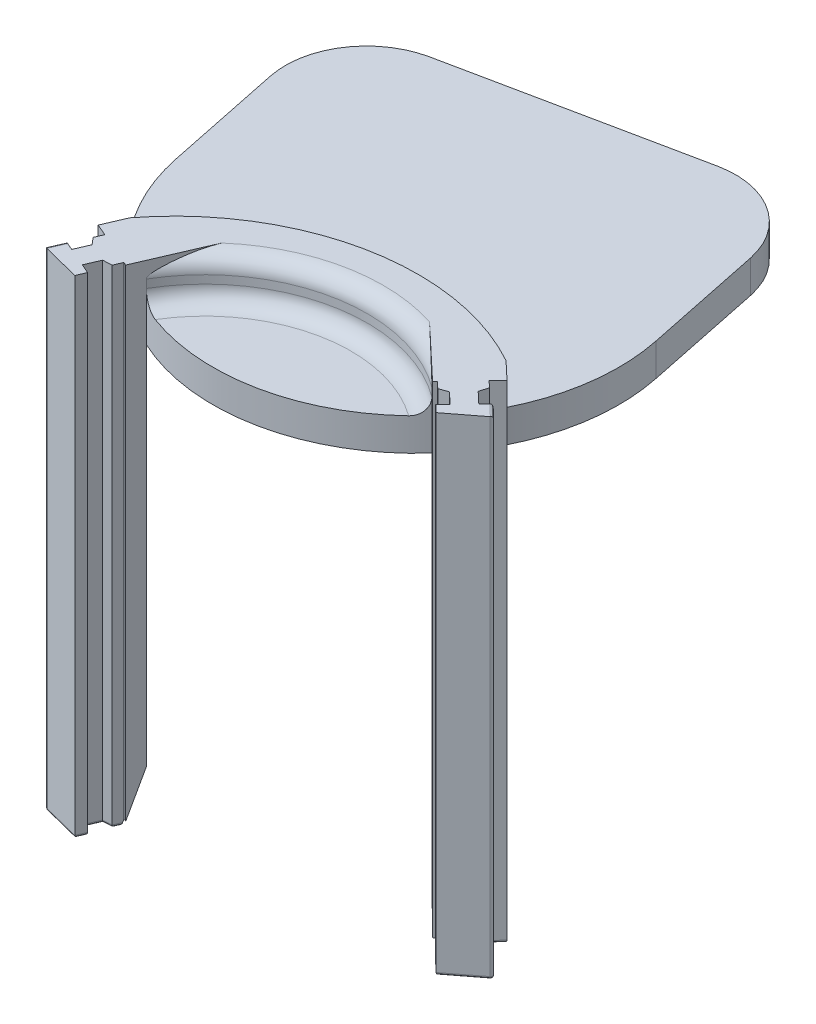
from build123d import *
from OCP.BRepFilletAPI import BRepFilletAPI_MakeChamfer

# Parameters (mm, degrees)
SKETCH_1_R           = 25
EXTRUDE_1_DEPTH      = 4
EXTRUDE_2_DEPTH      = 5
EXTRUDE_2_DEPTH_BACK = 55
EXTRUDE_3_DEPTH      = 5
FILLET_1_R           = 2
CHAMFER_1_SIZE       = 6
CHAMFER_1_SIZE2      = 2.1838214055972194
CHAMFER_2_SIZE       = 1.5
CHAMFER_2_SIZE_2     = 1.205612412
FILLET_3_R           = 0.3
FILLET_4_R           = 0.3
EXTRUDE_START        = -4
EXTRUDE_4_DEPTH      = 4
FILLET_5_R           = 10


with BuildPart() as part:
    # 草图1 → 凸台-拉伸1 (new body)
    with BuildSketch(Plane(origin=(0, 0, 0), x_dir=(1, 0, 0), z_dir=(0, 1, 0))):
        with Locations(Location((0, 0, 0), (0, 0, 270))):
            Circle(SKETCH_1_R)
    extrude(amount=EXTRUDE_1_DEPTH)

    # 草图2 → 凸台-拉伸2 (add, two sides: drawn at the far end of the back side and taken through both)
    with BuildSketch(Plane(origin=(0, 4, 0), x_dir=(1, 0, 0), z_dir=(0, 1, 0)).offset(-EXTRUDE_2_DEPTH_BACK)):
        with BuildLine():
            ThreePointArc((22.332503325570293, -11.236516151075708), (20.662728753668315, -14.073082123412792), (18.634769791146837, -16.66569394987657))
            Line((18.634769791146837, -16.665693949876566), (20.041241701767298, -17.99217884081352))
            Line((20.041241701767298, -17.99217884081352), (20.33291534076991, -17.682917285609623))
            Line((20.33291534076991, -17.682917285609623), (21.12987507649821, -18.43455337599002))
            Line((21.12987507649821, -18.43455337599002), (22.1797380423832, -18.050121648809256))
            Line((22.1797380423832, -18.050121648809256), (23.565250010950724, -19.3568386039359))
            Line((23.565250010950724, -19.3568386039359), (22.70760290865611, -20.266201814059144))
            Line((22.70760290865611, -20.266201814059144), (23.58059159037443, -21.089543032261975))
            Line((23.58059159037443, -21.089543032261975), (27.59317245403172, -18.00098433723753))
            Line((27.59317245403172, -18.00098433723753), (26.13819131783453, -16.628748973566147))
            Line((26.13819131783453, -16.628748973566147), (25.280544215539912, -17.538112183689385))
            Line((25.280544215539912, -17.538112183689385), (23.895032246972406, -16.231395228562743))
            Line((23.895032246972406, -16.231395228562743), (24.217404644758776, -15.160845819546308))
            Line((24.217404644758776, -15.160845819546308), (23.420444909030483, -14.409209729165896))
            Line((23.420444909030483, -14.409209729165896), (24.49191969238528, -13.27312503191597))
            Line((24.49191969238528, -13.27312503191597), (22.33250332557029, -11.23651615107571))
        make_face()
        with BuildLine():
            ThreePointArc((-16.04897580423937, -19.168473482125453), (-13.3915934082896, -21.110784589566084), (-10.502070341010478, -22.68714434547619))
            Line((-10.502070341010478, -22.68714434547619), (-11.267516680153959, -24.462480173746464))
            Line((-11.267516680153959, -24.462480173746464), (-11.657885741287837, -24.294170288933902))
            Line((-11.657885741287837, -24.294170288933902), (-12.091616345896137, -25.300142155021895))
            Line((-12.091616345896137, -25.300142155021895), (-13.207861579430748, -25.36336065398598))
            Line((-13.207861579430748, -25.36336065398598), (-13.961900857550162, -27.11223954713794))
            Line((-13.961900857550162, -27.11223954713794), (-12.814046374533504, -27.60714366494114))
            Line((-12.814046374533504, -27.60714366494114), (-13.289154327624585, -28.70908396863715))
            Line((-13.289154327624585, -28.70908396863715), (-18.19731089508523, -27.464094366554956))
            Line((-18.19731089508523, -27.464094366554956), (-17.40546430660011, -25.627527193728316))
            Line((-17.40546430660011, -25.627527193728316), (-16.25760982358345, -26.122431311531514))
            Line((-16.25760982358345, -26.122431311531514), (-15.503570545464036, -24.37355241837955))
            Line((-15.503570545464036, -24.37355241837955), (-16.223892484756064, -23.518487330930324))
            Line((-16.223892484756064, -23.518487330930324), (-15.79016188014775, -22.51251546484231))
            Line((-15.79016188014775, -22.51251546484231), (-17.22419824571416, -21.894222368549144))
            Line((-17.22419824571416, -21.894222368549144), (-16.04897580423937, -19.168473482125453))
        make_face()
    extrude(amount=EXTRUDE_2_DEPTH + EXTRUDE_2_DEPTH_BACK)

    # 草图3 → 凸台-拉伸3 (add)
    with BuildSketch(Plane(origin=(0, 4, 0), x_dir=(1, 0, 0), z_dir=(0, 1, 0))):
        with BuildLine():
            ThreePointArc((-10.502070341010494, -22.687144345476195), (2.7240849225224126, -13.181413393683862), (18.63476979114697, -16.665693949876687))
            ThreePointArc((18.63476979114697, -16.665693949876687), (20.662728753668432, -14.0730821234129), (22.332503325570396, -11.236516151075817))
            ThreePointArc((22.332503325570396, -11.236516151075817), (1.6674612067741998, -8.068579398056713), (-16.048975804239276, -19.168473482125343))
            ThreePointArc((-16.048975804239276, -19.168473482125343), (-13.39159340828953, -21.110784589565984), (-10.502070341010494, -22.687144345476195))
        make_face()
    extrude(amount=EXTRUDE_3_DEPTH)

    # 圆角1
    # the kernel refuses this fillet: 2 mm, written as the material it adds along each edge
    with BuildSketch(Plane(origin=(6.771773946405894, 4, 32.767536378234254), x_dir=(-0.9615700147021181, 0, -0.2745598419757852), z_dir=(-0.2745598419757852, 0, 0.9615700147021181))) as fillet_1_piece_1_section:
        with BuildLine():
            CenterArc((20 - FILLET_1_R, -FILLET_1_R), FILLET_1_R, 0, 90)
            Line((20, -FILLET_1_R), (20, 0))
            Line((20, 0), (20 - FILLET_1_R, 0))
        make_face()
    fillet_1_piece_1 = revolve(axis=Axis((6.771773946405894, 4, 32.767536378234254), (0, -1, 0)), revolution_arc=124.77556932584883, mode=Mode.PRIVATE)
    fillet_1_piece_1 = fillet_1_piece_1 & Plane(origin=(0, 4, 0), x_dir=(-1.8e-16, 0, 1), z_dir=(0, -1, 0)) * Cylinder(25, 80, mode=Mode.PRIVATE)
    add(fillet_1_piece_1)
    # the kernel refuses this fillet: 2 mm, written as the material it takes off along each edge
    with BuildSketch(Plane(origin=(6.771773946405894, 9, 32.767536378234254), x_dir=(-0.9754376414268184, 0, 0.22027575374445013), z_dir=(0.22027575374445013, 0, 0.9754376414268184))) as fillet_1_2_piece_1_section:
        with BuildLine():
            CenterArc((20 + FILLET_1_R, FILLET_1_R), FILLET_1_R, 180, 90.00000000000023)
            Line((20 + FILLET_1_R, 0), (20, 0))
            Line((20, 0), (20, FILLET_1_R))
        make_face()
    fillet_1_2_piece_1 = revolve(axis=Axis((6.771773946405894, 9, 32.767536378234254), (0, -1, 0)), revolution_arc=182.09759971066305, mode=Mode.PRIVATE)
    fillet_1_2_piece_1 = split(fillet_1_2_piece_1, bisect_by=Plane(origin=(20.393508222166147, 9, 18.32441172322201), z_dir=(-0.6861176818356919, 0, 0.7274905680985948)), keep=Keep.TOP, mode=Mode.PRIVATE)
    fillet_1_2_piece_1 = split(fillet_1_2_piece_1, bisect_by=Plane(origin=(-11.459231222339927, 9, 24.907132761573898), z_dir=(0.9182835864133222, 0, 0.3959232942425675)), keep=Keep.TOP, mode=Mode.PRIVATE)
    add(fillet_1_2_piece_1, mode=Mode.SUBTRACT)

    # 倒角1: one chamfer whose edges measure the first distance from different faces: ONE call of the kernel's chamfer builder (chamfer() names one face for all edges)
    chamfer_1_edges_1 = [part.edges().sort_by_distance(p)[0] for p in [
        (20.662728753668315, -51, 14.07308212341279),
    ]]
    chamfer_1_side_1 = [part.faces().sort_by_distance(p)[0] for p in [
        (20.662728753668432, -25.5, 14.07308212341262),
    ]]
    chamfer_1_edges_2 = [part.edges().sort_by_distance(p)[0] for p in [
        (-13.391593408289594, -51, 21.110784589566087),
    ]]
    chamfer_1_side_2 = [part.faces().sort_by_distance(p)[0] for p in [
        (-13.391593408289655, -25.5, 21.110784589566045),
    ]]
    chamfer_1 = BRepFilletAPI_MakeChamfer(part.part.solid().wrapped)
    for e in chamfer_1_edges_1:
        chamfer_1.Add(CHAMFER_1_SIZE, CHAMFER_1_SIZE2, e.wrapped, chamfer_1_side_1[0].wrapped)  # the first distance lies on this face
    for e in chamfer_1_edges_2:
        chamfer_1.Add(CHAMFER_1_SIZE, CHAMFER_1_SIZE2, e.wrapped, chamfer_1_side_2[0].wrapped)  # the first distance lies on this face
    add(Compound.cast(chamfer_1.Shape()), mode=Mode.REPLACE)

    # 倒角2
    # the kernel refuses this chamfer: 1.5, 1.205612412 mm, written as the material it takes off along each edge
    with BuildSketch(Plane(origin=(22.332503325570293, 0, 11.236516151075708), x_dir=(-0.47116075086138987, 0, 0.8820473608870054), z_dir=(0, -1, 0))) as chamfer_2_piece_1:
        with BuildLine():
            Line((1.222119237738874, -1e-17), (CHAMFER_2_SIZE * 0.262423288211, -CHAMFER_2_SIZE * 0.964952857815))
            Line((CHAMFER_2_SIZE * 0.262423288211, -CHAMFER_2_SIZE * 0.964952857815), (0, 0))
            ThreePointArc((0, 0), (0.625982518906451, -0.00746453901404494), (1.222119237738874, -1e-17))
        make_face()
    extrude(amount=51.55779161931309, mode=Mode.SUBTRACT)
    with BuildSketch(Plane(origin=(-16.04897580423937, -48.98240907030912, 19.168473482125453), x_dir=(-0.3959232942425711, 0, 0.9182835864133205), z_dir=(0, 1, 0))) as chamfer_2_piece_2:
        with BuildLine():
            Line((CHAMFER_2_SIZE_2, 3e-17), (0.396644602606295, 1.497059162425037))
            ThreePointArc((0.396644602606295, 1.497059162425037), (0.21551433141200554, 0.7666183767278043), (0, 0))
            Line((0, 0), (CHAMFER_2_SIZE_2, 3e-17))
        make_face()
    extrude(amount=48.98240907030912, mode=Mode.SUBTRACT)

    # 圆角3
    # the kernel refuses this fillet: 0.3 mm, written as the material it takes off along each edge
    with BuildSketch(Plane(origin=(-15.79016188014775, -51, 22.51251546484231), x_dir=(0, 1, 0), z_dir=(-0.9182835864133239, 0, -0.39592329424256356))) as fillet_3_piece_1:
        with BuildLine():
            CenterArc((FILLET_3_R, FILLET_3_R), FILLET_3_R, 180, 90)
            Line((0, FILLET_3_R), (0, 0))
            Line((0, 0), (FILLET_3_R, 0))
        make_face()
    extrude(amount=2.311648696311276, mode=Mode.SUBTRACT)
    with BuildSketch(Plane(origin=(-16.52083495543801, -51, 24.20720002074031), x_dir=(0, 1, 0), z_dir=(0.39592329424259415, 0, -0.9182835864133108))) as fillet_3_piece_2:
        with BuildLine():
            CenterArc((FILLET_3_R, FILLET_3_R), FILLET_3_R, 180, 90)
            Line((0, FILLET_3_R), (0, 0))
            Line((0, 0), (FILLET_3_R, 0))
        make_face()
    extrude(amount=1.8454915028125507, mode=Mode.SUBTRACT)
    with BuildSketch(Plane(origin=(-15.0203638988816, -51, 24.947147516596534), x_dir=(0, 1, 0), z_dir=(-0.6442755287765851, 0, -0.7647934642893149))) as fillet_3_piece_3_section:
        with BuildLine():
            CenterArc((FILLET_3_R, FILLET_3_R), FILLET_3_R, 180.00000000000026, 89.99999999999977)
            Line((0, FILLET_3_R), (0, 0))
            Line((0, 0), (FILLET_3_R, 0))
        make_face()
    fillet_3_piece_3 = extrude(amount=2.6180339887498807, mode=Mode.PRIVATE)
    fillet_3_piece_3 = split(fillet_3_piece_3, bisect_by=Plane(origin=(-15.636367255434342, -51, 24.68155409665593), z_dir=(-0.9182835864133249, 0, -0.3959232942425614)), keep=Keep.TOP, mode=Mode.PRIVATE)
    add(fillet_3_piece_3, mode=Mode.SUBTRACT)
    with BuildSketch(Plane(origin=(-16.25760982358345, -51, 26.122431311531514), x_dir=(0, 1, 0), z_dir=(0.3959232942425614, 0, -0.9182835864133249))) as fillet_3_piece_4_section:
        with BuildLine():
            CenterArc((FILLET_3_R, FILLET_3_R), FILLET_3_R, 180.0000000000003, 89.99999999999966)
            Line((0, FILLET_3_R), (0, 0))
            Line((0, 0), (FILLET_3_R, 0))
        make_face()
    fillet_3_piece_4 = extrude(amount=2.654508497187472, mode=Mode.PRIVATE)
    fillet_3_piece_4 = split(fillet_3_piece_4, bisect_by=Plane(origin=(-14.954826843827128, -51, 25.024943908257733), z_dir=(-0.7647934642893149, 0, 0.6442755287765851)), keep=Keep.TOP, mode=Mode.PRIVATE)
    add(fillet_3_piece_4, mode=Mode.SUBTRACT)
    with BuildSketch(Plane(origin=(-18.094176996410106, -51, 25.330584723046396), x_dir=(4.31e-15, 1, -9.99e-15), z_dir=(0.9182835864133262, 0, 0.39592329424255845))) as fillet_3_piece_5:
        with BuildLine():
            CenterArc((FILLET_3_R, FILLET_3_R), FILLET_3_R, 180, 90.00000000000063)
            Line((-3.26e-15, FILLET_3_R), (0, 0))
            Line((0, 0), (FILLET_3_R, 0))
        make_face()
    extrude(amount=2.000000000000003, mode=Mode.SUBTRACT)
    with BuildSketch(Plane(origin=(-18.49425336576715, -51, 28.152807056364946), x_dir=(-9.99e-15, 1, -4.31e-15), z_dir=(0.3959232942425625, 0, -0.9182835864133243))) as fillet_3_piece_6:
        with BuildLine():
            CenterArc((FILLET_3_R, FILLET_3_R), FILLET_3_R, 180.00000000000063, 90)
            Line((-3.26e-15, FILLET_3_R), (0, 0))
            Line((0, 0), (FILLET_3_R, 0))
        make_face()
    extrude(amount=3.4999999999999822, mode=Mode.SUBTRACT)
    with BuildSketch(Plane(origin=(-12.562177344246667, -51, 28.893486966548615), x_dir=(-3.6e-16, 1, 1.41e-15), z_dir=(-0.9693026445038965, 0, -0.2458706638819543))) as fillet_3_piece_7:
        with BuildLine():
            CenterArc((FILLET_3_R, FILLET_3_R), FILLET_3_R, 180, 90.00000000000006)
            Line((-4.4e-16, FILLET_3_R), (0, 0))
            Line((0, 0), (FILLET_3_R, 0))
        make_face()
    extrude(amount=6.563595560468844, mode=Mode.SUBTRACT)
    with BuildSketch(Plane(origin=(-12.517103903851584, -51, 26.918430975131148), x_dir=(0, 1, 0), z_dir=(-0.3959232942425612, 0, 0.918283586413325))) as fillet_3_piece_8:
        with BuildLine():
            CenterArc((FILLET_3_R, FILLET_3_R), FILLET_3_R, 180, 90)
            Line((0, FILLET_3_R), (0, 0))
            Line((0, 0), (FILLET_3_R, 0))
        make_face()
    extrude(amount=2.700000000000018, mode=Mode.SUBTRACT)
    with BuildSketch(Plane(origin=(-13.961900857550162, -51, 27.11223954713794), x_dir=(0, 1, 0), z_dir=(0.9182835864133251, 0, 0.3959232942425608))) as fillet_3_piece_9:
        with BuildLine():
            CenterArc((FILLET_3_R, FILLET_3_R), FILLET_3_R, 180, 90)
            Line((0, FILLET_3_R), (0, 0))
            Line((0, 0), (FILLET_3_R, 0))
        make_face()
    extrude(amount=1.9999999999999993, mode=Mode.SUBTRACT)
    with BuildSketch(Plane(origin=(-12.910919108748827, -51, 24.674647964175985), x_dir=(0, 1, 0), z_dir=(-0.39592329424256206, 0, 0.9182835864133245))) as fillet_3_piece_10_section:
        with BuildLine():
            CenterArc((FILLET_3_R, FILLET_3_R), FILLET_3_R, 180, 90)
            Line((0, FILLET_3_R), (0, 0))
            Line((0, 0), (FILLET_3_R, 0))
        make_face()
    fillet_3_piece_10 = extrude(amount=2.6545084971874693, mode=Mode.PRIVATE)
    fillet_3_piece_10 = split(fillet_3_piece_10, bisect_by=Plane(origin=(-12.872988009370376, -51, 25.344395104296755), z_dir=(0.05654434444767595, 0, 0.9984000886974033)), keep=Keep.TOP, mode=Mode.PRIVATE)
    add(fillet_3_piece_10, mode=Mode.SUBTRACT)
    with BuildSketch(Plane(origin=(-11.34281627937308, -51, 25.257733896686137), x_dir=(-2e-17, 1, -3.3e-16), z_dir=(-0.9984000886974033, 0, 0.05654434444767595))) as fillet_3_piece_11_section:
        with BuildLine():
            CenterArc((FILLET_3_R, FILLET_3_R), FILLET_3_R, 180, 90)
            Line((1e-16, FILLET_3_R), (0, 0))
            Line((0, 0), (FILLET_3_R, 0))
        make_face()
    fillet_3_piece_11 = extrude(amount=2.6180339887499082, mode=Mode.PRIVATE)
    fillet_3_piece_11 = split(fillet_3_piece_11, bisect_by=Plane(origin=(-12.877103222339173, -51, 24.59621718250296), z_dir=(0.9182835864133245, 0, 0.39592329424256206)), keep=Keep.TOP, mode=Mode.PRIVATE)
    add(fillet_3_piece_11, mode=Mode.SUBTRACT)
    with BuildSketch(Plane(origin=(-11.454986429527157, -51, 23.82357633704021), x_dir=(-4.31e-15, 1, -1.86e-15), z_dir=(-0.3959232942425903, 0, 0.9182835864133124))) as fillet_3_piece_12:
        with BuildLine():
            CenterArc((FILLET_3_R, FILLET_3_R), FILLET_3_R, 180, 89.99999999999972)
            Line((1.41e-15, FILLET_3_R), (0, 0))
            Line((0, 0), (FILLET_3_R, 0))
        make_face()
    extrude(amount=2.3579627686137226, mode=Mode.SUBTRACT)
    with BuildSketch(Plane(origin=(-8.0647e-13, -51, 8.2778e-13), x_dir=(-0.6384487948747662, 0, 0.7696643010579083), z_dir=(-0.7696643010579083, 0, -0.6384487948747662))) as fillet_3_piece_13:
        with BuildLine():
            CenterArc((27.183821405596213 + FILLET_3_R * 0.70020753821, FILLET_3_R), FILLET_3_R, 199.99999999999991, 70.00000000000075)
            Line((27.183821405596213 + FILLET_3_R * 0.70020753821, 0), (27.183821405596213, 0))
            Line((27.183821405596213, 0), (27.183821405596213 - FILLET_3_R * 0.239485082576, FILLET_3_R * 0.657979856674))
        make_face()
    revolve(axis=Axis((-8.0647e-13, -51, 8.2778e-13), (0, 1, 0)), revolution_arc=15.168674338711297, mode=Mode.SUBTRACT)
    with BuildSketch(Plane(origin=(-17.521140716396086, -51, 22.582935058359134), x_dir=(0, 1, 0), z_dir=(0.3959232942425718, 0, -0.9182835864133204))) as fillet_3_piece_14:
        with BuildLine():
            CenterArc((FILLET_3_R, FILLET_3_R), FILLET_3_R, 180, 90)
            Line((0, FILLET_3_R), (0, 0))
            Line((0, 0), (FILLET_3_R, 0))
        make_face()
    extrude(amount=2.1974345774697372, mode=Mode.SUBTRACT)
    with BuildSketch(Plane(origin=(20.425605588864702, -51, 18.692438018395173), x_dir=(-0.3438461898735354, 0, -0.9390259835113471), z_dir=(0.9390259835113471, 0, -0.3438461898735353))) as fillet_3_piece_15_section:
        with BuildLine():
            CenterArc((FILLET_3_R, FILLET_3_R), FILLET_3_R, 180, 90)
            Line((-1.22e-15, FILLET_3_R), (0, 0))
            Line((0, 0), (FILLET_3_R, 0))
        make_face()
    fillet_3_piece_15 = extrude(amount=2.6180339887498953, mode=Mode.PRIVATE)
    fillet_3_piece_15 = split(fillet_3_piece_15, bisect_by=Plane(origin=(21.57198500384515, -51, 17.476931941319044), z_dir=(-0.6861176818356887, 0, 0.727490568098598)), keep=Keep.TOP, mode=Mode.PRIVATE)
    add(fillet_3_piece_15, mode=Mode.SUBTRACT)
    with BuildSketch(Plane(origin=(21.63412011630925, -51, 17.53553338743249), x_dir=(0.6861176818356886, 0, -0.7274905680985979), z_dir=(0.727490568098598, 0, 0.6861176818356887))) as fillet_3_piece_16_section:
        with BuildLine():
            CenterArc((FILLET_3_R, FILLET_3_R), FILLET_3_R, 180, 90)
            Line((-2.58e-15, FILLET_3_R), (0, 0))
            Line((0, 0), (FILLET_3_R, 0))
        make_face()
    fillet_3_piece_16 = extrude(amount=2.6545084971874755, mode=Mode.PRIVATE)
    fillet_3_piece_16 = split(fillet_3_piece_16, bisect_by=Plane(origin=(21.864779152617707, -51, 18.165451166963482), z_dir=(0.3438461898735353, 0, 0.9390259835113471)), keep=Keep.TOP, mode=Mode.PRIVATE)
    add(fillet_3_piece_16, mode=Mode.SUBTRACT)
    with BuildSketch(Plane(origin=(23.565250010950724, -51, 19.3568386039359), x_dir=(0.7274905680985962, 0, 0.6861176818356907), z_dir=(-0.6861176818356906, 0, 0.7274905680985962))) as fillet_3_piece_17:
        with BuildLine():
            CenterArc((FILLET_3_R, FILLET_3_R), FILLET_3_R, 180, 90)
            Line((0, FILLET_3_R), (0, 0))
            Line((0, 0), (FILLET_3_R, 0))
        make_face()
    extrude(amount=1.9999999999999976, mode=Mode.SUBTRACT)
    with BuildSketch(Plane(origin=(22.161984982582165, -51, 19.75161355268238), x_dir=(0.6861176818356902, 0, -0.7274905680985964), z_dir=(0.7274905680985965, 0, 0.6861176818356903))) as fillet_3_piece_18:
        with BuildLine():
            CenterArc((FILLET_3_R, FILLET_3_R), FILLET_3_R, 180, 90)
            Line((-2.58e-15, FILLET_3_R), (0, 0))
            Line((0, 0), (FILLET_3_R, 0))
        make_face()
    extrude(amount=2.699999999999997, mode=Mode.SUBTRACT)
    with BuildSketch(Plane(origin=(22.986263782830427, -51, 21.547008284690996), x_dir=(-0.6099536699053572, 0, -0.7924370767253301), z_dir=(0.7924370767253301, 0, -0.6099536699053572))) as fillet_3_piece_19:
        with BuildLine():
            CenterArc((FILLET_3_R, FILLET_3_R), FILLET_3_R, 180, 90)
            Line((0, FILLET_3_R), (0, 0))
            Line((0, 0), (FILLET_3_R, 0))
        make_face()
    extrude(amount=6.563595560468856, mode=Mode.SUBTRACT)
    with BuildSketch(Plane(origin=(28.138790380105664, -51, 18.515572598614295), x_dir=(-0.6861176818356914, 0, 0.7274905680985952), z_dir=(-0.7274905680985954, 0, -0.6861176818356914))) as fillet_3_piece_20:
        with BuildLine():
            CenterArc((FILLET_3_R, FILLET_3_R), FILLET_3_R, 180, 90)
            Line((0, FILLET_3_R), (0, 0))
            Line((0, 0), (FILLET_3_R, 0))
        make_face()
    extrude(amount=3.499999999999993, mode=Mode.SUBTRACT)
    with BuildSketch(Plane(origin=(26.6527795792113, -51, 16.083131047492206), x_dir=(0.727490568098592, 0, 0.6861176818356949), z_dir=(-0.6861176818356949, 0, 0.7274905680985921))) as fillet_3_piece_21:
        with BuildLine():
            CenterArc((FILLET_3_R, FILLET_3_R), FILLET_3_R, 180, 90)
            Line((-2.58e-15, FILLET_3_R), (0, 0))
            Line((0, 0), (FILLET_3_R, 0))
        make_face()
    extrude(amount=1.9999999999999947, mode=Mode.SUBTRACT)
    with BuildSketch(Plane(origin=(25.280544215539912, -51, 17.538112183689385), x_dir=(-0.6861176818356933, 0, 0.7274905680985935), z_dir=(-0.7274905680985936, 0, -0.6861176818356934))) as fillet_3_piece_22_section:
        with BuildLine():
            CenterArc((FILLET_3_R, FILLET_3_R), FILLET_3_R, 180, 90)
            Line((0, FILLET_3_R), (0, 0))
            Line((0, 0), (FILLET_3_R, 0))
        make_face()
    fillet_3_piece_22 = extrude(amount=2.6545084971874626, mode=Mode.PRIVATE)
    fillet_3_piece_22 = split(fillet_3_piece_22, bisect_by=Plane(origin=(23.649447858635256, -51, 17.046943407015114), z_dir=(0.9575285007332007, 0, 0.2883386382079743)), keep=Keep.TOP, mode=Mode.PRIVATE)
    add(fillet_3_piece_22, mode=Mode.SUBTRACT)
    with BuildSketch(Plane(origin=(23.678778268316425, -51, 16.949541604112643), x_dir=(-0.9575285007332006, 0, -0.28833863820797423), z_dir=(0.2883386382079743, 0, -0.9575285007332007))) as fillet_3_piece_23_section:
        with BuildLine():
            CenterArc((FILLET_3_R, FILLET_3_R), FILLET_3_R, 180, 90)
            Line((0, FILLET_3_R), (0, 0))
            Line((0, 0), (FILLET_3_R, 0))
        make_face()
    fillet_3_piece_23 = extrude(amount=2.618033988749881, mode=Mode.PRIVATE)
    fillet_3_piece_23 = split(fillet_3_piece_23, bisect_by=Plane(origin=(24.139040001461176, -51, 16.46152609513513), z_dir=(0.6861176818356933, 0, -0.7274905680985935)), keep=Keep.TOP, mode=Mode.PRIVATE)
    add(fillet_3_piece_23, mode=Mode.SUBTRACT)
    with BuildSketch(Plane(origin=(24.76302257083274, -51, 15.675434080923063), x_dir=(-0.6861176818356722, 0, 0.7274905680986133), z_dir=(-0.7274905680986135, 0, -0.6861176818356722))) as fillet_3_piece_24:
        with BuildLine():
            CenterArc((FILLET_3_R, FILLET_3_R), FILLET_3_R, 180, 90)
            Line((1.29e-15, FILLET_3_R), (0, 0))
            Line((0, 0), (FILLET_3_R, 0))
        make_face()
    extrude(amount=1.8454915028125354, mode=Mode.SUBTRACT)
    with BuildSketch(Plane(origin=(23.420444909030483, -51, 14.409209729165896), x_dir=(-0.7274905680986045, 0, -0.6861176818356817), z_dir=(0.6861176818356818, 0, -0.7274905680986045))) as fillet_3_piece_25:
        with BuildLine():
            CenterArc((FILLET_3_R, FILLET_3_R), FILLET_3_R, 180, 90)
            Line((-1.5e-16, FILLET_3_R), (0, 0))
            Line((0, 0), (FILLET_3_R, 0))
        make_face()
    extrude(amount=2.3116486963112637, mode=Mode.SUBTRACT)
    with BuildSketch(Plane(origin=(25.037537618459233, -51, 13.787713293292734), x_dir=(-0.6861176818356847, 0, 0.7274905680986016), z_dir=(-0.7274905680986017, 0, -0.6861176818356848))) as fillet_3_piece_26:
        with BuildLine():
            CenterArc((FILLET_3_R, FILLET_3_R), FILLET_3_R, 180, 90)
            Line((0, FILLET_3_R), (0, 0))
            Line((0, 0), (FILLET_3_R, 0))
        make_face()
    extrude(amount=2.1974345774697217, mode=Mode.SUBTRACT)
    with BuildSketch(Plane(origin=(-3.7303e-13, -51, -4.6185e-13), x_dir=(0.8912370425977303, 0, 0.45353779765489394), z_dir=(0.45353779765489394, 0, -0.8912370425977303))) as fillet_3_piece_27:
        with BuildLine():
            CenterArc((27.18382140559763 + FILLET_3_R * 0.70020753821, -FILLET_3_R), FILLET_3_R, 90.00000000000068, 69.99999999999943)
            Line((27.18382140559763 + FILLET_3_R * 0.70020753821, 0), (27.18382140559763, 0))
            Line((27.18382140559763, 0), (27.18382140559763 - FILLET_3_R * 0.239485082576, -FILLET_3_R * 0.657979856674))
        make_face()
    revolve(axis=Axis((-3.7303e-13, -51, -4.6185e-13), (0, -1, 0)), revolution_arc=15.168674338710499, mode=Mode.SUBTRACT)
    with BuildSketch(Plane(origin=(19.960097328477968, -51, 17.331301688710706), x_dir=(0, 1, 0), z_dir=(0.7274905680986214, 0, 0.6861176818356637))) as fillet_3_piece_28:
        with BuildLine():
            CenterArc((FILLET_3_R, -FILLET_3_R), FILLET_3_R, 90, 90)
            Line((0, -FILLET_3_R), (0, 0))
            Line((0, 0), (FILLET_3_R, 0))
        make_face()
    extrude(amount=2.357962768613739, mode=Mode.SUBTRACT)
    with BuildSketch(Plane(origin=(-16.52083495543801, -51, 24.20720002074031), x_dir=(0, 1, 0), z_dir=(0.39592329424259415, 0, -0.9182835864133108))) as fillet_3_piece_29a_section:
        with BuildLine():
            CenterArc((FILLET_3_R, FILLET_3_R), FILLET_3_R, 180, 90)
            Line((0, FILLET_3_R), (0, 0))
            Line((0, 0), (FILLET_3_R, 0))
        make_face()
    fillet_3_piece_29a = extrude(amount=2.595491502812554, mode=Mode.PRIVATE)
    fillet_3_piece_29a = split(fillet_3_piece_29a, bisect_by=Plane(origin=(-15.790161880147805, -51, 22.512515464842284), z_dir=(0.39592329424256356, 0, -0.9182835864133239)), keep=Keep.TOP, mode=Mode.PRIVATE)
    with BuildSketch(Plane(origin=(-15.101449190337759, -51, 22.809457935524232), x_dir=(0, 1, 0), z_dir=(-0.9182835864133239, 0, -0.39592329424256356))) as fillet_3_piece_29b_section:
        with BuildLine():
            CenterArc((FILLET_3_R, FILLET_3_R), FILLET_3_R, 180, 90)
            Line((0, FILLET_3_R), (0, 0))
            Line((0, 0), (FILLET_3_R, 0))
        make_face()
    fillet_3_piece_29b = extrude(amount=3.0616486963112743, mode=Mode.PRIVATE)
    fillet_3_piece_29b = split(fillet_3_piece_29b, bisect_by=Plane(origin=(-15.79016188014774, -51, 22.512515464842288), z_dir=(0.9182835864133108, 0, 0.39592329424259415)), keep=Keep.TOP, mode=Mode.PRIVATE)
    fillet_3_piece_29 = fillet_3_piece_29a & fillet_3_piece_29b
    add(fillet_3_piece_29, mode=Mode.SUBTRACT)
    with BuildSketch(Plane(origin=(-16.25760982358345, -51, 26.122431311531514), x_dir=(0, 1, 0), z_dir=(0.3959232942425614, 0, -0.9182835864133249))) as fillet_3_piece_30a_section:
        with BuildLine():
            CenterArc((FILLET_3_R, FILLET_3_R), FILLET_3_R, 180.0000000000003, 89.99999999999966)
            Line((0, FILLET_3_R), (0, 0))
            Line((0, 0), (FILLET_3_R, 0))
        make_face()
    fillet_3_piece_30a = extrude(amount=2.654508497187472, mode=Mode.PRIVATE)
    fillet_3_piece_30a = split(fillet_3_piece_30a, bisect_by=Plane(origin=(-14.954826843827128, -51, 25.024943908257733), z_dir=(0.7647934642893149, 0, -0.6442755287765851)), keep=Keep.TOP, mode=Mode.PRIVATE)
    with BuildSketch(Plane(origin=(-15.0203638988816, -51, 24.947147516596534), x_dir=(0, 1, 0), z_dir=(-0.6442755287765851, 0, -0.7647934642893149))) as fillet_3_piece_30b_section:
        with BuildLine():
            CenterArc((FILLET_3_R, FILLET_3_R), FILLET_3_R, 180.00000000000026, 89.99999999999977)
            Line((0, FILLET_3_R), (0, 0))
            Line((0, 0), (FILLET_3_R, 0))
        make_face()
    fillet_3_piece_30b = extrude(amount=2.6180339887498807, mode=Mode.PRIVATE)
    fillet_3_piece_30b = split(fillet_3_piece_30b, bisect_by=Plane(origin=(-15.636367255434344, -51, 24.68155409665593), z_dir=(0.9182835864133249, 0, 0.3959232942425614)), keep=Keep.TOP, mode=Mode.PRIVATE)
    fillet_3_piece_30 = fillet_3_piece_30a & fillet_3_piece_30b
    add(fillet_3_piece_30, mode=Mode.SUBTRACT)
    with BuildSketch(Plane(origin=(-18.094176996410106, -51, 25.330584723046396), x_dir=(4.31e-15, 1, -9.99e-15), z_dir=(0.9182835864133262, 0, 0.39592329424255845))) as fillet_3_piece_31a_section:
        with BuildLine():
            CenterArc((FILLET_3_R, FILLET_3_R), FILLET_3_R, 180, 90.00000000000063)
            Line((-3.26e-15, FILLET_3_R), (0, 0))
            Line((0, 0), (FILLET_3_R, 0))
        make_face()
    fillet_3_piece_31a = extrude(amount=2.7500000000000053, mode=Mode.PRIVATE)
    fillet_3_piece_31a = split(fillet_3_piece_31a, bisect_by=Plane(origin=(-16.257609823583454, -51, 26.12243131153152), z_dir=(0.9182835864133249, 0, 0.3959232942425614)), keep=Keep.TOP, mode=Mode.PRIVATE)
    with BuildSketch(Plane(origin=(-16.55455229426537, -51, 26.811144001341507), x_dir=(0, 1, 0), z_dir=(0.3959232942425614, 0, -0.9182835864133249))) as fillet_3_piece_31b_section:
        with BuildLine():
            CenterArc((FILLET_3_R, FILLET_3_R), FILLET_3_R, 180.00000000000063, 89.99999999999937)
            Line((0, FILLET_3_R), (0, 0))
            Line((0, 0), (FILLET_3_R, 0))
        make_face()
    fillet_3_piece_31b = extrude(amount=3.404508497187471, mode=Mode.PRIVATE)
    fillet_3_piece_31b = split(fillet_3_piece_31b, bisect_by=Plane(origin=(-16.25760982358345, -51, 26.122431311531514), z_dir=(-0.3959232942425584, 0, 0.9182835864133261)), keep=Keep.TOP, mode=Mode.PRIVATE)
    fillet_3_piece_31 = fillet_3_piece_31a & fillet_3_piece_31b
    add(fillet_3_piece_31, mode=Mode.SUBTRACT)
    with BuildSketch(Plane(origin=(-12.910919108748827, -51, 24.674647964175985), x_dir=(0, 1, 0), z_dir=(-0.39592329424256206, 0, 0.9182835864133245))) as fillet_3_piece_32a_section:
        with BuildLine():
            CenterArc((FILLET_3_R, FILLET_3_R), FILLET_3_R, 180, 90)
            Line((0, FILLET_3_R), (0, 0))
            Line((0, 0), (FILLET_3_R, 0))
        make_face()
    fillet_3_piece_32a = extrude(amount=3.404508497187469, mode=Mode.PRIVATE)
    fillet_3_piece_32a = split(fillet_3_piece_32a, bisect_by=Plane(origin=(-13.961900857550159, -51, 27.11223954713794), z_dir=(-0.3959232942425608, 0, 0.9182835864133251)), keep=Keep.TOP, mode=Mode.PRIVATE)
    with BuildSketch(Plane(origin=(-14.650613547360154, -51, 26.81529707645602), x_dir=(0, 1, 0), z_dir=(0.9182835864133251, 0, 0.3959232942425608))) as fillet_3_piece_32b_section:
        with BuildLine():
            CenterArc((FILLET_3_R, FILLET_3_R), FILLET_3_R, 180, 90)
            Line((0, FILLET_3_R), (0, 0))
            Line((0, 0), (FILLET_3_R, 0))
        make_face()
    fillet_3_piece_32b = extrude(amount=2.7499999999999964, mode=Mode.PRIVATE)
    fillet_3_piece_32b = split(fillet_3_piece_32b, bisect_by=Plane(origin=(-13.961900857550162, -51, 27.11223954713794), z_dir=(-0.9182835864133245, 0, -0.39592329424256206)), keep=Keep.TOP, mode=Mode.PRIVATE)
    fillet_3_piece_32 = fillet_3_piece_32a & fillet_3_piece_32b
    add(fillet_3_piece_32, mode=Mode.SUBTRACT)
    with BuildSketch(Plane(origin=(-11.34281627937308, -51, 25.257733896686137), x_dir=(-2e-17, 1, -3.3e-16), z_dir=(-0.9984000886974033, 0, 0.05654434444767595))) as fillet_3_piece_33a_section:
        with BuildLine():
            CenterArc((FILLET_3_R, FILLET_3_R), FILLET_3_R, 180, 90)
            Line((1e-16, FILLET_3_R), (0, 0))
            Line((0, 0), (FILLET_3_R, 0))
        make_face()
    fillet_3_piece_33a = extrude(amount=2.6180339887499082, mode=Mode.PRIVATE)
    fillet_3_piece_33a = split(fillet_3_piece_33a, bisect_by=Plane(origin=(-12.877103222339173, -51, 24.59621718250296), z_dir=(-0.9182835864133245, 0, -0.39592329424256206)), keep=Keep.TOP, mode=Mode.PRIVATE)
    with BuildSketch(Plane(origin=(-12.910919108748827, -51, 24.674647964175985), x_dir=(0, 1, 0), z_dir=(-0.39592329424256206, 0, 0.9182835864133245))) as fillet_3_piece_33b_section:
        with BuildLine():
            CenterArc((FILLET_3_R, FILLET_3_R), FILLET_3_R, 180, 90)
            Line((0, FILLET_3_R), (0, 0))
            Line((0, 0), (FILLET_3_R, 0))
        make_face()
    fillet_3_piece_33b = extrude(amount=2.6545084971874693, mode=Mode.PRIVATE)
    fillet_3_piece_33b = split(fillet_3_piece_33b, bisect_by=Plane(origin=(-12.872988009370376, -51, 25.344395104296755), z_dir=(-0.05654434444767595, 0, -0.9984000886974033)), keep=Keep.TOP, mode=Mode.PRIVATE)
    fillet_3_piece_33 = fillet_3_piece_33a & fillet_3_piece_33b
    add(fillet_3_piece_33, mode=Mode.SUBTRACT)
    with BuildSketch(Plane(origin=(20.425605588864702, -51, 18.692438018395173), x_dir=(-0.3438461898735354, 0, -0.9390259835113471), z_dir=(0.9390259835113471, 0, -0.3438461898735353))) as fillet_3_piece_34a_section:
        with BuildLine():
            CenterArc((FILLET_3_R, FILLET_3_R), FILLET_3_R, 180, 90)
            Line((-1.22e-15, FILLET_3_R), (0, 0))
            Line((0, 0), (FILLET_3_R, 0))
        make_face()
    fillet_3_piece_34a = extrude(amount=2.6180339887498953, mode=Mode.PRIVATE)
    fillet_3_piece_34a = split(fillet_3_piece_34a, bisect_by=Plane(origin=(21.57198500384515, -51, 17.476931941319044), z_dir=(0.6861176818356887, 0, -0.727490568098598)), keep=Keep.TOP, mode=Mode.PRIVATE)
    with BuildSketch(Plane(origin=(21.63412011630925, -51, 17.53553338743249), x_dir=(0.6861176818356886, 0, -0.7274905680985979), z_dir=(0.727490568098598, 0, 0.6861176818356887))) as fillet_3_piece_34b_section:
        with BuildLine():
            CenterArc((FILLET_3_R, FILLET_3_R), FILLET_3_R, 180, 90)
            Line((-2.58e-15, FILLET_3_R), (0, 0))
            Line((0, 0), (FILLET_3_R, 0))
        make_face()
    fillet_3_piece_34b = extrude(amount=2.6545084971874755, mode=Mode.PRIVATE)
    fillet_3_piece_34b = split(fillet_3_piece_34b, bisect_by=Plane(origin=(21.86477915261771, -51, 18.165451166963486), z_dir=(-0.3438461898735353, 0, -0.9390259835113471)), keep=Keep.TOP, mode=Mode.PRIVATE)
    fillet_3_piece_34 = fillet_3_piece_34a & fillet_3_piece_34b
    add(fillet_3_piece_34, mode=Mode.SUBTRACT)
    with BuildSketch(Plane(origin=(21.63412011630925, -51, 17.53553338743249), x_dir=(0.6861176818356886, 0, -0.7274905680985979), z_dir=(0.727490568098598, 0, 0.6861176818356887))) as fillet_3_piece_35a_section:
        with BuildLine():
            CenterArc((FILLET_3_R, FILLET_3_R), FILLET_3_R, 180, 90)
            Line((-2.58e-15, FILLET_3_R), (0, 0))
            Line((0, 0), (FILLET_3_R, 0))
        make_face()
    fillet_3_piece_35a = extrude(amount=3.4045084971874746, mode=Mode.PRIVATE)
    fillet_3_piece_35a = split(fillet_3_piece_35a, bisect_by=Plane(origin=(23.56525001095072, -51, 19.356838603935905), z_dir=(0.7274905680985962, 0, 0.6861176818356906)), keep=Keep.TOP, mode=Mode.PRIVATE)
    with BuildSketch(Plane(origin=(24.07983827232749, -51, 18.811220677861954), x_dir=(0.7274905680985962, 0, 0.6861176818356907), z_dir=(-0.6861176818356906, 0, 0.7274905680985962))) as fillet_3_piece_35b_section:
        with BuildLine():
            CenterArc((FILLET_3_R, FILLET_3_R), FILLET_3_R, 180, 90)
            Line((0, FILLET_3_R), (0, 0))
            Line((0, 0), (FILLET_3_R, 0))
        make_face()
    fillet_3_piece_35b = extrude(amount=2.7499999999999942, mode=Mode.PRIVATE)
    fillet_3_piece_35b = split(fillet_3_piece_35b, bisect_by=Plane(origin=(23.565250010950724, -51, 19.3568386039359), z_dir=(0.6861176818356887, 0, -0.727490568098598)), keep=Keep.TOP, mode=Mode.PRIVATE)
    fillet_3_piece_35 = fillet_3_piece_35a & fillet_3_piece_35b
    add(fillet_3_piece_35, mode=Mode.SUBTRACT)
    with BuildSketch(Plane(origin=(25.826162141613857, -51, 18.052700445066154), x_dir=(-0.6861176818356933, 0, 0.7274905680985935), z_dir=(-0.7274905680985936, 0, -0.6861176818356934))) as fillet_3_piece_36a_section:
        with BuildLine():
            CenterArc((FILLET_3_R, FILLET_3_R), FILLET_3_R, 180, 90)
            Line((0, FILLET_3_R), (0, 0))
            Line((0, 0), (FILLET_3_R, 0))
        make_face()
    fillet_3_piece_36a = extrude(amount=3.4045084971874617, mode=Mode.PRIVATE)
    fillet_3_piece_36a = split(fillet_3_piece_36a, bisect_by=Plane(origin=(25.280544215539916, -51, 17.538112183689385), z_dir=(0.7274905680985921, 0, 0.6861176818356949)), keep=Keep.TOP, mode=Mode.PRIVATE)
    with BuildSketch(Plane(origin=(26.6527795792113, -51, 16.083131047492206), x_dir=(0.727490568098592, 0, 0.6861176818356949), z_dir=(-0.6861176818356949, 0, 0.7274905680985921))) as fillet_3_piece_36b_section:
        with BuildLine():
            CenterArc((FILLET_3_R, FILLET_3_R), FILLET_3_R, 180, 90)
            Line((-2.58e-15, FILLET_3_R), (0, 0))
            Line((0, 0), (FILLET_3_R, 0))
        make_face()
    fillet_3_piece_36b = extrude(amount=2.749999999999994, mode=Mode.PRIVATE)
    fillet_3_piece_36b = split(fillet_3_piece_36b, bisect_by=Plane(origin=(25.280544215539916, -51, 17.53811218368939), z_dir=(-0.6861176818356933, 0, 0.7274905680985935)), keep=Keep.TOP, mode=Mode.PRIVATE)
    fillet_3_piece_36 = fillet_3_piece_36a & fillet_3_piece_36b
    add(fillet_3_piece_36, mode=Mode.SUBTRACT)
    with BuildSketch(Plane(origin=(23.678778268316425, -51, 16.949541604112643), x_dir=(-0.9575285007332006, 0, -0.28833863820797423), z_dir=(0.2883386382079743, 0, -0.9575285007332007))) as fillet_3_piece_37a_section:
        with BuildLine():
            CenterArc((FILLET_3_R, FILLET_3_R), FILLET_3_R, 180, 90)
            Line((0, FILLET_3_R), (0, 0))
            Line((0, 0), (FILLET_3_R, 0))
        make_face()
    fillet_3_piece_37a = extrude(amount=2.618033988749881, mode=Mode.PRIVATE)
    fillet_3_piece_37a = split(fillet_3_piece_37a, bisect_by=Plane(origin=(24.139040001461176, -51, 16.46152609513513), z_dir=(-0.6861176818356933, 0, 0.7274905680985935)), keep=Keep.TOP, mode=Mode.PRIVATE)
    with BuildSketch(Plane(origin=(25.280544215539912, -51, 17.538112183689385), x_dir=(-0.6861176818356933, 0, 0.7274905680985935), z_dir=(-0.7274905680985936, 0, -0.6861176818356934))) as fillet_3_piece_37b_section:
        with BuildLine():
            CenterArc((FILLET_3_R, FILLET_3_R), FILLET_3_R, 180, 90)
            Line((0, FILLET_3_R), (0, 0))
            Line((0, 0), (FILLET_3_R, 0))
        make_face()
    fillet_3_piece_37b = extrude(amount=2.6545084971874626, mode=Mode.PRIVATE)
    fillet_3_piece_37b = split(fillet_3_piece_37b, bisect_by=Plane(origin=(23.649447858635256, -51, 17.046943407015114), z_dir=(-0.9575285007332007, 0, -0.2883386382079743)), keep=Keep.TOP, mode=Mode.PRIVATE)
    fillet_3_piece_37 = fillet_3_piece_37a & fillet_3_piece_37b
    add(fillet_3_piece_37, mode=Mode.SUBTRACT)
    with BuildSketch(Plane(origin=(22.90585664765372, -51, 14.95482765523985), x_dir=(-0.7274905680986045, 0, -0.6861176818356817), z_dir=(0.6861176818356818, 0, -0.7274905680986045))) as fillet_3_piece_38a_section:
        with BuildLine():
            CenterArc((FILLET_3_R, FILLET_3_R), FILLET_3_R, 180, 90)
            Line((-1.5e-16, FILLET_3_R), (0, 0))
            Line((0, 0), (FILLET_3_R, 0))
        make_face()
    fillet_3_piece_38a = extrude(amount=3.061648696311264, mode=Mode.PRIVATE)
    fillet_3_piece_38a = split(fillet_3_piece_38a, bisect_by=Plane(origin=(23.420444909030476, -51, 14.40920972916589), z_dir=(-0.6861176818356722, 0, 0.7274905680986135)), keep=Keep.TOP, mode=Mode.PRIVATE)
    with BuildSketch(Plane(origin=(24.76302257083274, -51, 15.675434080923063), x_dir=(-0.6861176818356722, 0, 0.7274905680986133), z_dir=(-0.7274905680986135, 0, -0.6861176818356722))) as fillet_3_piece_38b_section:
        with BuildLine():
            CenterArc((FILLET_3_R, FILLET_3_R), FILLET_3_R, 180, 90)
            Line((1.29e-15, FILLET_3_R), (0, 0))
            Line((0, 0), (FILLET_3_R, 0))
        make_face()
    fillet_3_piece_38b = extrude(amount=2.595491502812538, mode=Mode.PRIVATE)
    fillet_3_piece_38b = split(fillet_3_piece_38b, bisect_by=Plane(origin=(23.4204449090305, -51, 14.409209729165878), z_dir=(-0.7274905680986045, 0, -0.6861176818356818)), keep=Keep.TOP, mode=Mode.PRIVATE)
    fillet_3_piece_38 = fillet_3_piece_38a & fillet_3_piece_38b
    add(fillet_3_piece_38, mode=Mode.SUBTRACT)

    # 圆角4
    # the kernel refuses this fillet: 0.3 mm, written as the material it takes off along each edge
    with BuildSketch(Plane(origin=(-17.782533774936823, -50.7, 27.25980474119505), x_dir=(-0.2458706638819543, 0, 0.9693026445038965), z_dir=(0, -1, 0))) as fillet_4_piece_1_section:
        Polygon((0, 0), (FILLET_4_R, 1e-17), (FILLET_4_R, FILLET_4_R * 1.17271911209), (-FILLET_4_R * 0.157990501107, FILLET_4_R * 0.987440631917), align=None)
    fillet_4_piece_1 = extrude(amount=FILLET_4_R, mode=Mode.PRIVATE)
    fillet_4_piece_1 = fillet_4_piece_1 - Plane(origin=(-17.782533774936823, -50.7, 27.25980474119505), x_dir=(0.8970921054031621, 0, -0.4418435859252932), z_dir=(0, -1, 0)) * Sphere(FILLET_4_R, mode=Mode.PRIVATE)
    add(fillet_4_piece_1, mode=Mode.SUBTRACT)
    with BuildSketch(Plane(origin=(-17.248756218948884, -50.7, 26.021789257925082), x_dir=(0.3959232942425584, 0, -0.9182835864133261), z_dir=(-0.9182835864133243, 0, -0.3959232942425625))) as fillet_4_piece_2_section:
        Polygon((0, 0), (FILLET_4_R, 0), (FILLET_4_R, FILLET_4_R), (0, FILLET_4_R), align=None)
    fillet_4_piece_2 = extrude(amount=FILLET_4_R, mode=Mode.PRIVATE)
    fillet_4_piece_2 = fillet_4_piece_2 - Plane(origin=(-17.248756218948884, -50.7, 26.021789257925082), x_dir=(-0.2799600461886298, 0.7071067811865475, 0.6493245510051658), z_dir=(-0.9182835864133243, 0, -0.3959232942425625)) * Sphere(FILLET_4_R, mode=Mode.PRIVATE)
    add(fillet_4_piece_2, mode=Mode.SUBTRACT)
    with BuildSketch(Plane(origin=(26.150603183713397, -50.7, 17.052831448546428), x_dir=(-0.7274905680985921, 0, -0.6861176818356949), z_dir=(0.6861176818356914, 0, -0.7274905680985954))) as fillet_4_piece_3_section:
        Polygon((0, 0), (FILLET_4_R, 0), (FILLET_4_R, -FILLET_4_R), (0, -FILLET_4_R), align=None)
    fillet_4_piece_3 = extrude(amount=FILLET_4_R, mode=Mode.PRIVATE)
    fillet_4_piece_3 = fillet_4_piece_3 - Plane(origin=(26.150603183713397, -50.7, 17.052831448546428), x_dir=(0.5144135139517683, 0.7071067811865475, 0.4851584655180139), z_dir=(0.6861176818356914, 0, -0.7274905680985954)) * Sphere(FILLET_4_R, mode=Mode.PRIVATE)
    add(fillet_4_piece_3, mode=Mode.SUBTRACT)
    with BuildSketch(Plane(origin=(27.131394521557862, -50.7, 17.977844512076853), x_dir=(0.6861176818356914, 0, -0.7274905680985954), z_dir=(0, -1, 0))) as fillet_4_piece_4_section:
        Polygon((0, 0), (FILLET_4_R, 0), (FILLET_4_R, FILLET_4_R * 1.17271911209), (-FILLET_4_R * 0.157990501107, FILLET_4_R * 0.987440631917), align=None)
    fillet_4_piece_4 = extrude(amount=FILLET_4_R, mode=Mode.PRIVATE)
    fillet_4_piece_4 = fillet_4_piece_4 - Plane(origin=(27.131394521557862, -50.7, 17.977844512076853), x_dir=(-0.9987468390818407, 0, -0.050047491685714485), z_dir=(0, -1, 0)) * Sphere(FILLET_4_R, mode=Mode.PRIVATE)
    add(fillet_4_piece_4, mode=Mode.SUBTRACT)
    with BuildSketch(Plane(origin=(27.59317245403172, -50.7, 18.00098433723753), x_dir=(-0.7274905680985956, 0, -0.6861176818356912), z_dir=(0, 1, 0))) as fillet_4_piece_5:
        with BuildLine():
            CenterArc((FILLET_4_R * 1.17271911209, FILLET_4_R), FILLET_4_R, 170.90972307917858, 99.09027692082134)
            Line((FILLET_4_R * 0.185278480177, FILLET_4_R * 1.15799050111), (0, 0))
            Line((0, 0), (FILLET_4_R * 1.17271911209, 1e-17))
        make_face()
    extrude(amount=60.579539334070326, mode=Mode.SUBTRACT)
    with BuildSketch(Plane(origin=(28.138790380105668, 9, 18.515572598614302), x_dir=(0, -1, 0), z_dir=(-0.7274905680985954, 0, -0.6861176818356914))) as fillet_4_piece_6:
        with BuildLine():
            CenterArc((FILLET_4_R, FILLET_4_R), FILLET_4_R, 179.99999999999955, 90.00000000000045)
            Line((0, FILLET_4_R), (0, 0))
            Line((0, 0), (FILLET_4_R, 0))
        make_face()
    extrude(amount=3.500000000000008, mode=Mode.SUBTRACT)
    with BuildSketch(Plane(origin=(26.13819131783453, -50.7, 16.628748973566147), x_dir=(0.727490568098595, 0, 0.6861176818356917), z_dir=(0, 1, 0))) as fillet_4_piece_7:
        with BuildLine():
            CenterArc((FILLET_4_R, -FILLET_4_R), FILLET_4_R, 90, 90.00000000000045)
            Line((-2.57e-15, -FILLET_4_R), (0, 0))
            Line((0, 0), (FILLET_4_R, 1e-17))
        make_face()
    extrude(amount=60.45, mode=Mode.SUBTRACT)
    with BuildSketch(Plane(origin=(-17.40546430660011, 9.75, 25.627527193728316), x_dir=(-0.3959232942425742, 0, 0.9182835864133192), z_dir=(0, -1, 0))) as fillet_4_piece_8:
        with BuildLine():
            CenterArc((FILLET_4_R, -FILLET_4_R), FILLET_4_R, 89.99999999999885, 90.00000000000087)
            Line((-9.33e-15, -FILLET_4_R), (0, 0))
            Line((0, 0), (FILLET_4_R, 0))
        make_face()
    extrude(amount=60.449999999999996, mode=Mode.SUBTRACT)
    with BuildSketch(Plane(origin=(-18.19731089508523, 9.879539334070326, 27.464094366554956), x_dir=(0.9693026445038961, 0, 0.2458706638819553), z_dir=(0, -1, 0))) as fillet_4_piece_9:
        with BuildLine():
            CenterArc((FILLET_4_R * 1.17271911209, -FILLET_4_R), FILLET_4_R, 90.00000000000001, 99.09027692082219)
            Line((FILLET_4_R * 0.185278480177, -FILLET_4_R * 1.15799050111), (0, 0))
            Line((0, 0), (FILLET_4_R * 1.17271911209, 1e-17))
        make_face()
    extrude(amount=60.57953933407032, mode=Mode.SUBTRACT)
    with BuildSketch(Plane(origin=(-18.494253365767154, 9, 28.152807056364953), x_dir=(-9.99e-15, -1, -4.31e-15), z_dir=(0.3959232942425625, 0, -0.9182835864133243))) as fillet_4_piece_10:
        with BuildLine():
            CenterArc((FILLET_4_R, -FILLET_4_R), FILLET_4_R, 89.99999999999937, 90)
            Line((-3.26e-15, -FILLET_4_R), (0, 0))
            Line((0, 0), (FILLET_4_R, 0))
        make_face()
    extrude(amount=3.499999999999995, mode=Mode.SUBTRACT)

    # 草图5 → 凸台-拉伸4 (add)
    with BuildSketch(Plane(origin=(0, 4, 0), x_dir=(1, 0, 0), z_dir=(0, 1, 0)).offset(EXTRUDE_START)):
        with BuildLine():
            Line((-29.542265010542327, 19.423042450833673), (-24.482653730688003, -5.059611279854306))
            ThreePointArc((-24.482653730688, -5.059611279854305), (-20.889535920564537, 13.734165028258694), (-5.059611279854289, 24.482653730688007))
            Line((-5.059611279854291, 24.482653730688003), (-29.542265010542327, 19.423042450833673))
        make_face()
        with BuildLine():
            Line((19.42304245083376, 29.542265010542277), (-5.059611279854291, 24.482653730688003))
            ThreePointArc((-5.059611279854289, 24.482653730688007), (13.734165028258706, 20.88953592056453), (24.482653730688007, 5.059611279854273))
            Line((24.48265373068801, 5.059611279854276), (19.42304245083376, 29.542265010542277))
        make_face()
    extrude(amount=EXTRUDE_4_DEPTH)

    # 圆角5
    fillet_5_edges = [part.edges().sort_by_distance(p)[0] for p in [
        (-29.542265010542327, 2, -19.423042450833673),
        (19.42304245083376, 2, -29.542265010542277),
    ]]
    fillet(fillet_5_edges, radius=FILLET_5_R)


solid = part.part
